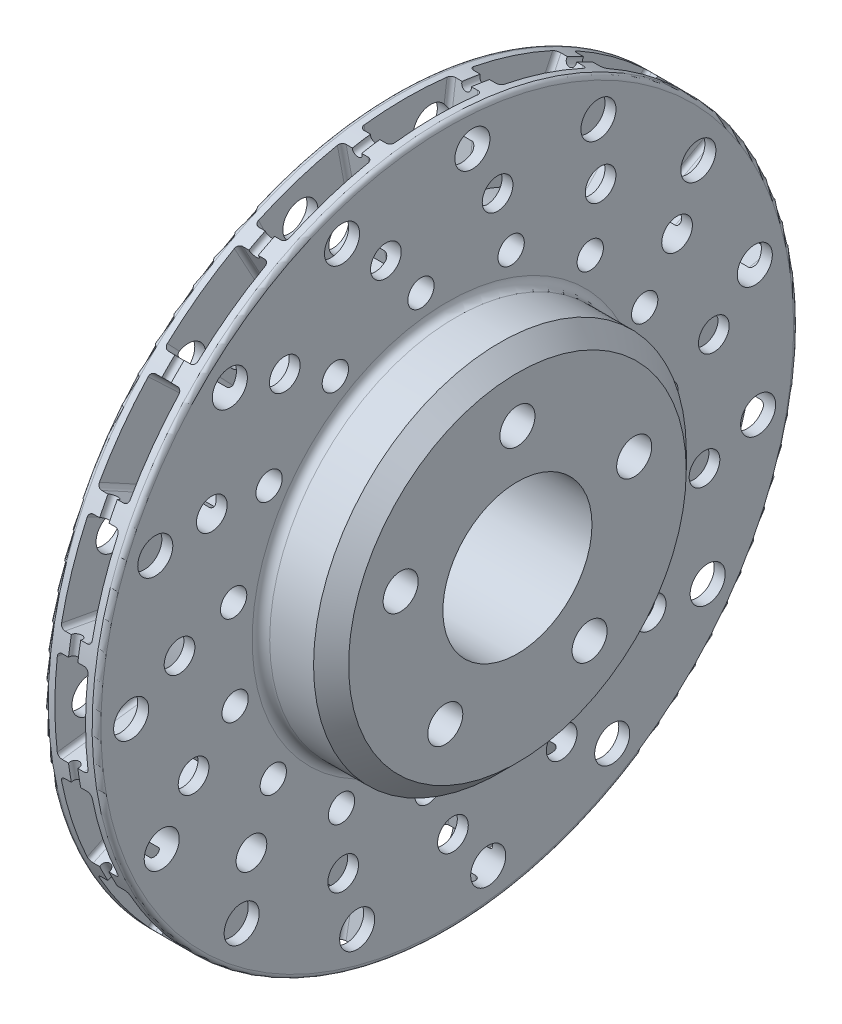
from build123d import *

# Parameters (mm, degrees)
SKETCH1_R                = 200
BOSS_EXTRUDE1_DEPTH      = 15
SKETCH2_R                = 106.25
BOSS_EXTRUDE2_DEPTH      = 40
SKETCH3_R                = 10
SKETCH3_R_2              = 42.5
CUT_EXTRUDE1_DEPTH       = 292.376045687
SKETCH4_W                = 17.5
SKETCH4_H                = 60
CUT_REVOLVE1_ANGLE       = 15
FILLET1_R                = 2.5
CIRPATTERN1_COUNT        = 20
FILLET1_OF_CIRPATTERN1_R = 2.5
SKETCH5_R                = 10
SKETCH5_R_2              = 8.75
SKETCH5_R_3              = 7.5
CUT_EXTRUDE2_DEPTH       = 286.657137282
CIRPATTERN2_COUNT        = 15
FILLET2_R                = 5
CHAMFER1_SIZE            = 10
SKETCH6_R                = 2.75
FILLET3_R                = 2.5


with BuildPart() as part:
    # Sketch1 → Boss-Extrude1 (new, symmetric)
    with BuildSketch(Plane(origin=(0, 0, 0), x_dir=(0, 0, -1), z_dir=(1, 0, 0))):
        Circle(SKETCH1_R)
    extrude(amount=BOSS_EXTRUDE1_DEPTH, both=True)

    # Sketch2 → Boss-Extrude2 (add)
    with BuildSketch(Plane(origin=(15, 0, 0), x_dir=(0, 0, -1), z_dir=(1, 0, 0))):
        Circle(SKETCH2_R)
    extrude(amount=BOSS_EXTRUDE2_DEPTH)

    # Sketch3 → Cut-Extrude1 (cut, through all)
    with BuildSketch(Plane(origin=(55, 0, 0), x_dir=(0, 0, -1), z_dir=(1, 0, 0))):
        with Locations((0, 70)):
            Circle(SKETCH3_R)
        with Locations((66.573956141, 21.631189606)):
            Circle(SKETCH3_R)
        with Locations((41.14496766, -56.631189606)):
            Circle(SKETCH3_R)
        with Locations((-41.14496766, -56.631189606)):
            Circle(SKETCH3_R)
        with Locations((-66.573956141, 21.631189606)):
            Circle(SKETCH3_R)
        Circle(SKETCH3_R_2)
    extrude(amount=-CUT_EXTRUDE1_DEPTH, mode=Mode.SUBTRACT)

    # Sketch4 → Cut-Revolve1 (revolve, symmetric, cut)
    with BuildSketch(Plane.XY) as cut_revolve1_sk:
        with Locations((0, 170)):
            Rectangle(SKETCH4_W, SKETCH4_H)
    cut_revolve1 = revolve(axis=Axis((0, 0, 0), (-1, 0, 0)), revolution_arc=CUT_REVOLVE1_ANGLE / 2, mode=Mode.SUBTRACT)
    cut_revolve1 = cut_revolve1 + revolve(cut_revolve1_sk.sketch, axis=Axis((0, 0, 0), (1, 0, 0)), revolution_arc=CUT_REVOLVE1_ANGLE / 2, mode=Mode.SUBTRACT)

    # Fillet1
    fillet1_edges = [part.edges().sort_by_distance(p)[0] for p in [
        (8.75, 168.545626434, 22.189452677),
        (-8.75, 168.545626434, 22.189452677),
        (8.75, 168.545626434, -22.189452677),
        (-8.75, 168.545626434, -22.189452677),
    ]]
    fillet(fillet1_edges, radius=FILLET1_R)

    # CirPattern1: Cut-Revolve1 ×20 about axis
    cirpattern1_axis = Axis((-15, 0, 0), (1, 0, 0))
    for i in range(1, CIRPATTERN1_COUNT):
        add(cut_revolve1.rotate(cirpattern1_axis, i * 360 / CIRPATTERN1_COUNT), mode=Mode.SUBTRACT)

    # Fillet1 of CirPattern1
    fillet1_of_cirpattern1_edges = [part.edges().sort_by_distance(p)[0] for p in [
        (8.75, 153.439498339, 73.186886457),
        (-8.75, 153.439498339, 73.186886457),
        (8.75, 167.153334286, 30.980039334),
        (-8.75, 167.153334286, 30.980039334),
        (8.75, 123.313643072, 117.020277868),
        (-8.75, 123.313643072, 117.020277868),
        (8.75, 149.398909153, 81.116989244),
        (-8.75, 149.398909153, 81.116989244),
        (8.75, 81.116989244, 149.398909153),
        (-8.75, 81.116989244, 149.398909153),
        (8.75, 117.020277868, 123.313643072),
        (-8.75, 117.020277868, 123.313643072),
        (8.75, 30.980039334, 167.153334286),
        (-8.75, 30.980039334, 167.153334286),
        (8.75, 73.186886457, 153.439498339),
        (-8.75, 73.186886457, 153.439498339),
        (8.75, -22.189452677, 168.545626434),
        (-8.75, -22.189452677, 168.545626434),
        (8.75, 22.189452677, 168.545626434),
        (-8.75, 22.189452677, 168.545626434),
        (8.75, -73.186886457, 153.439498339),
        (-8.75, -73.186886457, 153.439498339),
        (8.75, -30.980039334, 167.153334286),
        (-8.75, -30.980039334, 167.153334286),
        (8.75, -117.020277868, 123.313643072),
        (-8.75, -117.020277868, 123.313643072),
        (8.75, -81.116989244, 149.398909153),
        (-8.75, -81.116989244, 149.398909153),
        (8.75, -149.398909153, 81.116989244),
        (-8.75, -149.398909153, 81.116989244),
        (8.75, -123.313643072, 117.020277868),
        (-8.75, -123.313643072, 117.020277868),
        (8.75, -167.153334286, 30.980039334),
        (-8.75, -167.153334286, 30.980039334),
        (8.75, -153.439498339, 73.186886457),
        (-8.75, -153.439498339, 73.186886457),
        (8.75, -168.545626434, -22.189452677),
        (-8.75, -168.545626434, -22.189452677),
        (8.75, -168.545626434, 22.189452677),
        (-8.75, -168.545626434, 22.189452677),
        (8.75, -153.439498339, -73.186886457),
        (-8.75, -153.439498339, -73.186886457),
        (8.75, -167.153334286, -30.980039334),
        (-8.75, -167.153334286, -30.980039334),
        (8.75, -123.313643072, -117.020277868),
        (-8.75, -123.313643072, -117.020277868),
        (8.75, -149.398909153, -81.116989244),
        (-8.75, -149.398909153, -81.116989244),
        (8.75, -81.116989244, -149.398909153),
        (-8.75, -81.116989244, -149.398909153),
        (8.75, -117.020277868, -123.313643072),
        (-8.75, -117.020277868, -123.313643072),
        (8.75, -30.980039334, -167.153334286),
        (-8.75, -30.980039334, -167.153334286),
        (8.75, -73.186886457, -153.439498339),
        (-8.75, -73.186886457, -153.439498339),
        (8.75, 22.189452677, -168.545626434),
        (-8.75, 22.189452677, -168.545626434),
        (8.75, -22.189452677, -168.545626434),
        (-8.75, -22.189452677, -168.545626434),
        (8.75, 73.186886457, -153.439498339),
        (-8.75, 73.186886457, -153.439498339),
        (8.75, 30.980039334, -167.153334286),
        (-8.75, 30.980039334, -167.153334286),
        (8.75, 117.020277868, -123.313643072),
        (-8.75, 117.020277868, -123.313643072),
        (8.75, 81.116989244, -149.398909153),
        (-8.75, 81.116989244, -149.398909153),
        (8.75, 149.398909153, -81.116989244),
        (-8.75, 149.398909153, -81.116989244),
        (8.75, 123.313643072, -117.020277868),
        (-8.75, 123.313643072, -117.020277868),
        (8.75, 167.153334286, -30.980039334),
        (-8.75, 167.153334286, -30.980039334),
        (8.75, 153.439498339, -73.186886457),
        (-8.75, 153.439498339, -73.186886457),
    ]]
    fillet(fillet1_of_cirpattern1_edges, radius=FILLET1_OF_CIRPATTERN1_R)

    # Sketch5 → Cut-Extrude2 (cut, through all)
    with BuildSketch(Plane(origin=(15, 0, 0), x_dir=(0, 0, -1), z_dir=(1, 0, 0))):
        with Locations((-60, 170)):
            Circle(SKETCH5_R)
        with Locations((-35, 149.129501809)):
            Circle(SKETCH5_R_2)
        with Locations((-15, 123.201907239)):
            Circle(SKETCH5_R_3)
    cut_extrude2 = extrude(amount=-CUT_EXTRUDE2_DEPTH, mode=Mode.SUBTRACT)

    # CirPattern2: Cut-Extrude2 ×15 about axis
    cirpattern2_axis = Axis((55, 0, 0), (1, 0, 0))
    for i in range(1, CIRPATTERN2_COUNT):
        add(cut_extrude2.rotate(cirpattern2_axis, i * 360 / CIRPATTERN2_COUNT), mode=Mode.SUBTRACT)

    # Fillet2
    fillet2_edges = [part.edges().sort_by_distance(p)[0] for p in [
        (15, 0, 106.25),
    ]]
    fillet(fillet2_edges, radius=FILLET2_R)

    # Chamfer1
    chamfer1_edges = [part.edges().sort_by_distance(p)[0] for p in [
        (55, 0, 106.25),
    ]]
    chamfer(chamfer1_edges, length=CHAMFER1_SIZE)

    # Sketch6 → Cut-Revolve3 (revolve, cut)
    with BuildSketch(Plane.XY):
        with Locations((0, 199.288972275)):
            Circle(SKETCH6_R)
    revolve(axis=Axis((0, 0, 0), (1, 0, 0)), mode=Mode.SUBTRACT)

    # Fillet3
    fillet3_edges = [part.edges().sort_by_distance(p)[0] for p in [
        (-15, 0, 200),
        (15, 0, 200),
    ]]
    fillet(fillet3_edges, radius=FILLET3_R)


solid = part.part
